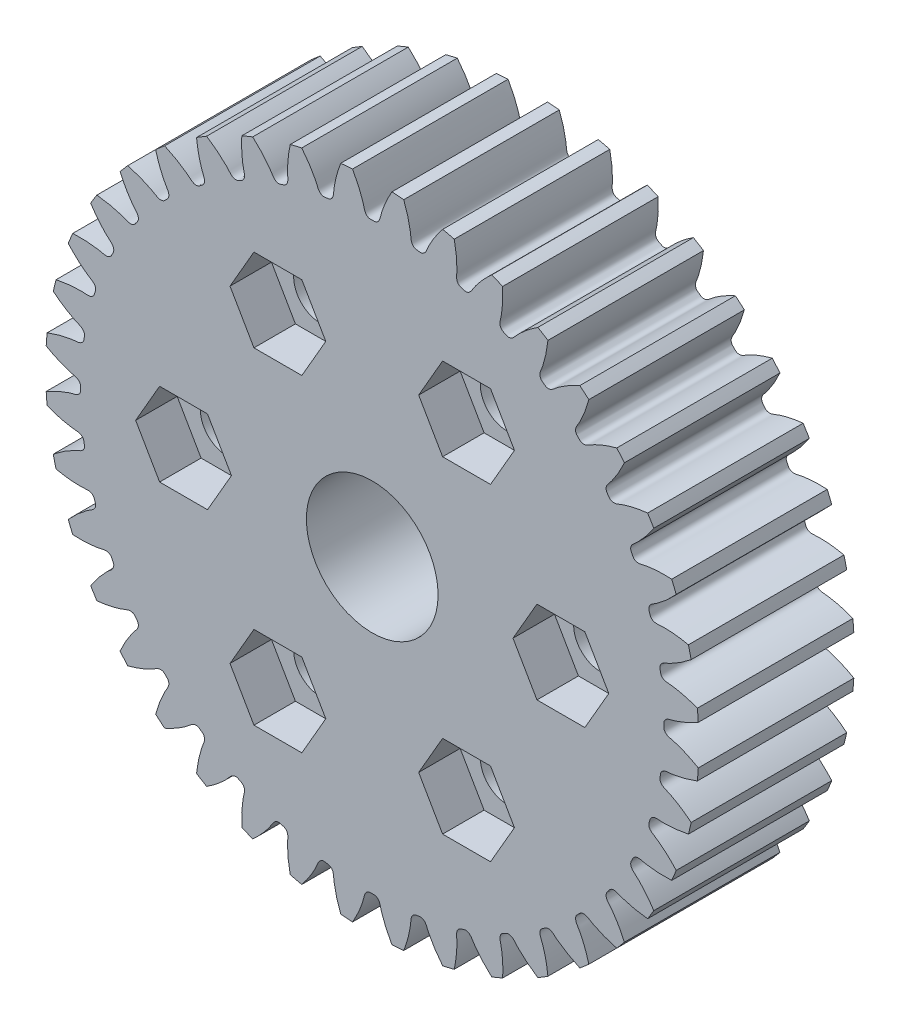
from build123d import *

# Parameters (mm, degrees)
SKETCHREVOLVESPURGEAR_W       = 15
SKETCHREVOLVESPURGEAR_H       = 31.499999527
TOOTHEXTRUDECUTSPURGEAR_DEPTH = 7.5
PATTERNSPURGEAR_COUNT         = 40
BOREREVOLVESKETCH_W           = 15
BOREREVOLVESKETCH_H           = 6.349999905
SKETCH1_R                     = 2.575
CUT_EXTRUDE1_DEPTH            = 15
CUT_EXTRUDE2_DEPTH            = 4


with BuildPart() as part:
    # SketchRevolveSpurGear → SpurGear (revolve)
    with BuildSketch(Plane(origin=(0, 0, 0), x_dir=(0, 0, -1), z_dir=(1, 0, 0))):
        with Locations((0, 15.749999764)):
            Rectangle(SKETCHREVOLVESPURGEAR_W, SKETCHREVOLVESPURGEAR_H)
    revolve(axis=Axis((0, 0, 0), (0, 0, -1)))

    # SketchToothSpurGear → ToothExtrudeCutSpurGear (cut, symmetric)
    with BuildSketch(Plane.XY):
        with BuildLine():
            ThreePointArc((31.515070175, 1.944465713), (31.574999526, 0), (31.515070175, -1.944465713))
            add(Edge.make_bspline(
                [(31.515070175, -1.944465713), (31.374963484, -1.862593145), (31.166569661, -1.745541299), (30.889853094, -1.59983158), (30.692293163, -1.500236917), (30.500989685, -1.408013221), (30.316139479, -1.322906045), (30.137932277, -1.244656255), (29.966550642, -1.173000245), (29.80216981, -1.1076703), (29.644957813, -1.048394015), (29.495074632, -0.994897115), (29.352674722, -0.946894552), (29.217897997, -0.904121746), (29.090900168, -0.866229069), (28.971749743, -0.833139659), (28.825841407, -0.794627398), (28.70602198, -0.769646758), (28.613974324, -0.741042785), (28.578666017, -0.728896906), (28.543817199, -0.715614216), (28.509290505, -0.701019846), (28.474931671, -0.684878249), (28.440575402, -0.666880003), (28.406054856, -0.646618019), (28.371222135, -0.623560785), (28.335986123, -0.597023177), (28.300377951, -0.566143141), (28.26465581, -0.529882046), (28.229453964, -0.487082557), (28.195962837, -0.436637359), (28.16605011, -0.377814525), (28.142260465, -0.310754402), (28.12785104, -0.240117672), (28.121982729, -0.135646355), (28.127148129, 0), (28.121982729, 0.135646355), (28.12785104, 0.240117672), (28.142260465, 0.310754402), (28.16605011, 0.377814525), (28.195962837, 0.436637359), (28.229453964, 0.487082557), (28.26465581, 0.529882046), (28.300377951, 0.566143141), (28.335986123, 0.597023177), (28.371222135, 0.623560785), (28.406054856, 0.646618019), (28.440575402, 0.666880003), (28.474931671, 0.684878249), (28.509290505, 0.701019846), (28.543817199, 0.715614216), (28.578666017, 0.728896906), (28.613974324, 0.741042785), (28.70602198, 0.769646758), (28.825841407, 0.794627398), (28.971749743, 0.833139659), (29.090900168, 0.866229069), (29.217897997, 0.904121746), (29.352674722, 0.946894552), (29.495074632, 0.994897115), (29.644957813, 1.048394015), (29.80216981, 1.1076703), (29.966550642, 1.173000245), (30.137932277, 1.244656255), (30.316139479, 1.322906045), (30.500989685, 1.408013221), (30.692293163, 1.500236917), (30.889853094, 1.59983158), (31.166569661, 1.745541299), (31.374963484, 1.862593145), (31.515070175, 1.944465713)],
                knots=[0, 0, 0, 0, 0.058940103, 0.086799122, 0.11358412, 0.139295096, 0.16393205, 0.187494983, 0.209983895, 0.231398784, 0.251739653, 0.271006499, 0.289199325, 0.306318128, 0.32236291, 0.337333671, 0.35123041, 0.377176171, 0.381719217, 0.386231503, 0.390736455, 0.395262328, 0.399843297, 0.404520763, 0.409344812, 0.414375698, 0.419684993, 0.425355674, 0.431479807, 0.438151613, 0.445453056, 0.453429776, 0.462059416, 0.471223266, 0.479505672, 0.5, 0.520494328, 0.528776734, 0.537940584, 0.546570224, 0.554546944, 0.561848387, 0.568520193, 0.574644326, 0.580315007, 0.585624302, 0.590655188, 0.595479237, 0.600156703, 0.604737672, 0.609263545, 0.613768497, 0.618280783, 0.622823829, 0.64876959, 0.662666329, 0.67763709, 0.693681872, 0.710800675, 0.728993501, 0.748260347, 0.768601216, 0.790016105, 0.812505017, 0.83606795, 0.860704904, 0.88641588, 0.913200878, 0.941059897, 1, 1, 1, 1], degree=3))
        make_face()
    toothextrudecutspurgear = extrude(amount=TOOTHEXTRUDECUTSPURGEAR_DEPTH, both=True, mode=Mode.SUBTRACT)

    # PatternSpurGear: ToothExtrudeCutSpurGear ×40 about axis
    patternspurgear_axis = Axis((0, 0, 55), (0, 0, -1))
    for i in range(1, PATTERNSPURGEAR_COUNT):
        add(toothextrudecutspurgear.rotate(patternspurgear_axis, i * 360 / PATTERNSPURGEAR_COUNT), mode=Mode.SUBTRACT)

    # BoreRevolveSketch → BoreRevolveCut (revolve, cut)
    with BuildSketch(Plane(origin=(0, 0, 0), x_dir=(0, 0, -1), z_dir=(1, 0, 0))):
        with Locations((0, 3.174999953)):
            Rectangle(BOREREVOLVESKETCH_W, BOREREVOLVESKETCH_H)
    revolve(axis=Axis((0, 0, 0), (0, 0, -1)), mode=Mode.SUBTRACT)

    # Sketch1 → Cut-Extrude1 (cut)
    with BuildSketch(Plane.XY.offset(7.5)):
        with Locations((-18, 0)):
            Circle(SKETCH1_R)
        with Locations((-9, 15.588457268)):
            Circle(SKETCH1_R)
        with Locations((9, 15.588457268)):
            Circle(SKETCH1_R)
        with Locations((18, 0)):
            Circle(SKETCH1_R)
        with Locations((9, -15.588457268)):
            Circle(SKETCH1_R)
        with Locations((-9, -15.588457268)):
            Circle(SKETCH1_R)
    extrude(amount=-CUT_EXTRUDE1_DEPTH, mode=Mode.SUBTRACT)

    # Sketch2 → Cut-Extrude2 (cut)
    with BuildSketch(Plane.XY.offset(7.5)):
        Polygon((11.406832852, -11.757214053), (6.788030698, -11.757214053), (4.478629622, -15.757214053), (6.788030698, -19.757214053), (11.406832852, -19.757214053), (13.716233929, -15.757214053), align=None)
        Polygon((20.504264627, -4), (22.813665704, 0), (20.504264627, 4), (15.885462473, 4), (13.576061397, 0), (15.885462473, -4), align=None)
        Polygon((-4.478629622, -15.757214053), (-6.788030698, -11.757214053), (-11.406832852, -11.757214053), (-13.716233929, -15.757214053), (-11.406832852, -19.757214053), (-6.788030698, -19.757214053), align=None)
        Polygon((-15.885462473, -4), (-13.576061397, 0), (-15.885462473, 4), (-20.504264627, 4), (-22.813665704, 0), (-20.504264627, -4), align=None)
        Polygon((-11.406832852, 11.757214053), (-6.788030698, 11.757214053), (-4.478629622, 15.757214053), (-6.788030698, 19.757214053), (-11.406832852, 19.757214053), (-13.716233929, 15.757214053), align=None)
        Polygon((4.478629622, 15.757214053), (6.788030698, 11.757214053), (11.406832852, 11.757214053), (13.716233929, 15.757214053), (11.406832852, 19.757214053), (6.788030698, 19.757214053), align=None)
    extrude(amount=-CUT_EXTRUDE2_DEPTH, mode=Mode.SUBTRACT)


solid = part.part
